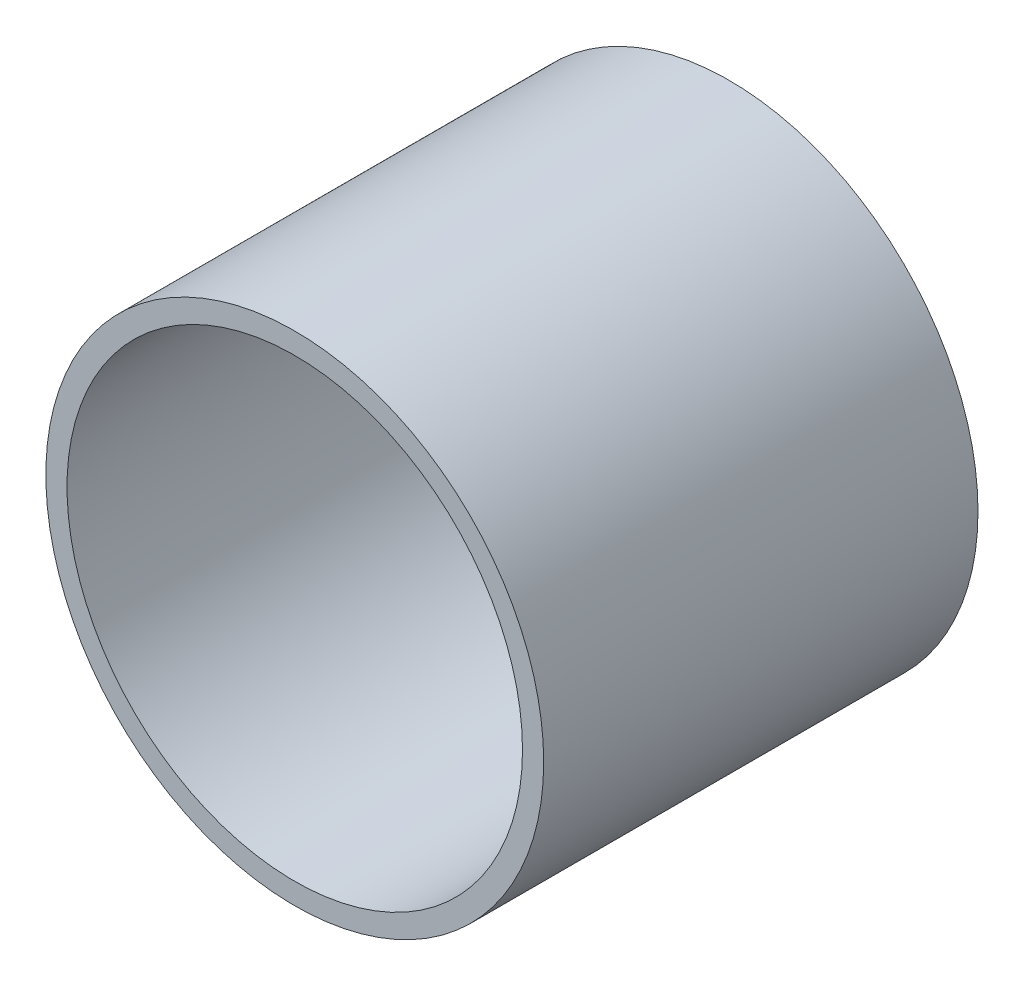
from build123d import *

# Parameters (mm, degrees)
SKETCH1_R           = 59.69
SKETCH1_R_2         = 54.61
BOSS_EXTRUDE1_DEPTH = 104.14
SKETCH2_R           = 3.3782
BOSS_EXTRUDE2_DEPTH = 6.35
CIRPATTERN1_COUNT   = 4


with BuildPart() as part:
    # Sketch1 → Boss-Extrude1 (new body)
    with BuildSketch(Plane.XY):
        Circle(SKETCH1_R)
        Circle(SKETCH1_R_2, mode=Mode.SUBTRACT)
    extrude(amount=BOSS_EXTRUDE1_DEPTH)

    # Sketch2 → Boss-Extrude2 (add)
    with BuildSketch(Plane(origin=(0, 0, 0), x_dir=(-1, 0, 0), z_dir=(0, 0, -1))):
        with BuildLine():
            Line((-48.26, 6.35), (-54.23955752, 6.35))
            ThreePointArc((-54.23955752, 6.35), (-54.61, 0), (-54.23955752, -6.35))
            Line((-54.23955752, -6.35), (-48.26, -6.35))
            ThreePointArc((-48.26, -6.35), (-41.91, 0), (-48.26, 6.35))
        make_face()
        with Locations((-48.26, 0)):
            Circle(SKETCH2_R, mode=Mode.SUBTRACT)
    boss_extrude2 = extrude(amount=-BOSS_EXTRUDE2_DEPTH)

    # CirPattern1: Boss-Extrude2 ×4 about axis
    cirpattern1_axis = Axis((0, 0, 104.14), (0, 0, -1))
    for i in range(1, CIRPATTERN1_COUNT):
        add(boss_extrude2.rotate(cirpattern1_axis, i * 360 / CIRPATTERN1_COUNT))


solid = part.part
